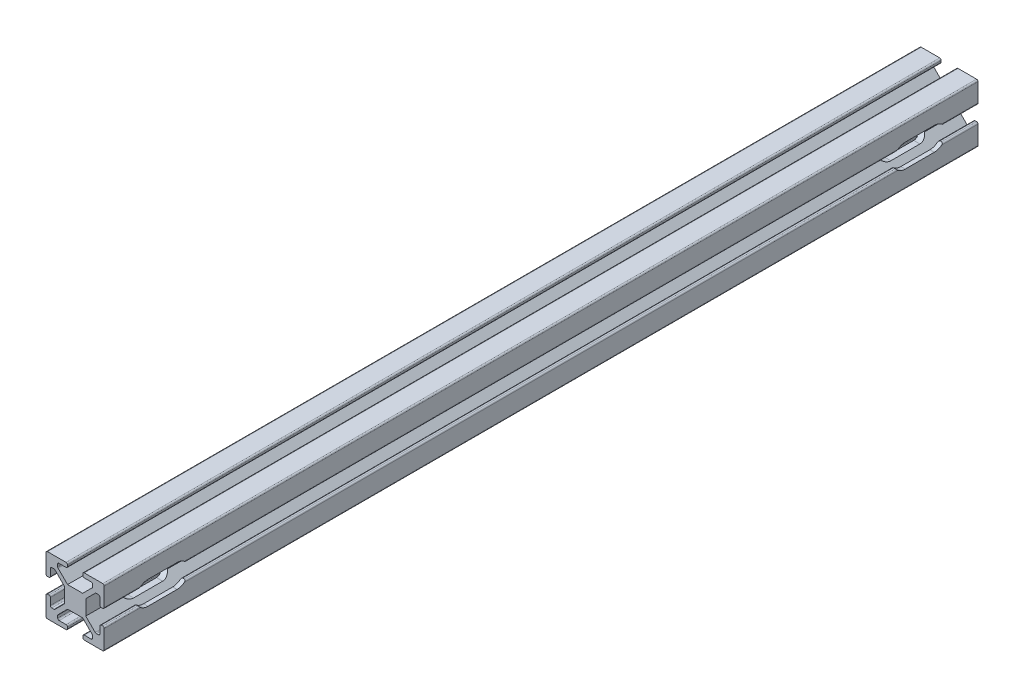
from build123d import *

# Parameters (mm, degrees)
BOSS_EXTRUDE1_DEPTH     = 300
FILLET1_R               = 0.5
CUT_EXTRUDE1_DEPTH      = 301.333148354
CUT_EXTRUDE1_DEPTH_BACK = 301.333148354


with BuildPart() as part:
    # Sketch1 → Boss-Extrude1 (new body)
    with BuildSketch(Plane.XY):
        Polygon((-10, 2.63), (-10, 10), (-2.63, 10), (-2.63, 8.5), (-5.995, 8.5), (-5.995, 7.055660172), (-2.594339828, 3.655), (2.594339828, 3.655), (5.995, 7.055660172), (5.995, 8.5), (2.63, 8.5), (2.63, 10), (10, 10), (10, 2.63), (8.5, 2.63), (8.5, 5.995), (7.055660172, 5.995), (3.655, 2.594339828), (3.655, -2.594339828), (7.055660172, -5.995), (8.5, -5.995), (8.5, -2.63), (10, -2.63), (10, -10), (2.63, -10), (2.63, -8.5), (5.995, -8.5), (5.995, -7.055660172), (2.594339828, -3.655), (-2.594339828, -3.655), (-5.995, -7.055660172), (-5.995, -8.5), (-2.63, -8.5), (-2.63, -10), (-10, -10), (-10, -2.63), (-8.5, -2.63), (-8.5, -5.995), (-7.055660172, -5.995), (-3.655, -2.594339828), (-3.655, 2.594339828), (-7.055660172, 5.995), (-8.5, 5.995), (-8.5, 2.63), align=None)
    extrude(amount=-BOSS_EXTRUDE1_DEPTH)

    # Fillet1
    fillet1_edges = [part.edges().sort_by_distance(p)[0] for p in [
        (10, 10, -150),
        (7.055660172, 5.995, -150),
        (8.5, 2.63, -150),
        (10, 2.63, -150),
        (8.5, 5.995, -150),
        (2.63, 10, -150),
        (2.63, 8.5, -150),
        (5.995, 8.5, -150),
        (5.995, 7.055660172, -150),
        (10, -10, -150),
        (10, -2.63, -150),
        (8.5, -2.63, -150),
        (8.5, -5.995, -150),
        (7.055660172, -5.995, -150),
        (5.995, -7.055660172, -150),
        (5.995, -8.5, -150),
        (2.63, -8.5, -150),
        (2.63, -10, -150),
        (-10, -10, -150),
        (-2.63, -10, -150),
        (-2.63, -8.5, -150),
        (-5.995, -8.5, -150),
        (-5.995, -7.055660172, -150),
        (-7.055660172, -5.995, -150),
        (-8.5, -5.995, -150),
        (-10, -2.63, -150),
        (-8.5, -2.63, -150),
        (-7.055660172, 5.995, -150),
        (-10, 10, -150),
        (-10, 2.63, -150),
        (-8.5, 2.63, -150),
        (-8.5, 5.995, -150),
        (-5.995, 8.5, -150),
        (-5.995, 7.055660172, -150),
        (-2.63, 8.5, -150),
        (-2.63, 10, -150),
    ]]
    fillet(fillet1_edges, radius=FILLET1_R)

    # Sketch2 → Cut-Extrude1 (cut, two sides: drawn at the far end of the back side and taken through both)
    with BuildSketch(Plane(origin=(0, 0, 0), x_dir=(0, 0, -1), z_dir=(1, 0, 0)).offset(-CUT_EXTRUDE1_DEPTH_BACK)):
        with BuildLine():
            Line((15, 4), (25, 4))
            ThreePointArc((25, 4), (29, 0), (25, -4))
            Line((25, -4), (15, -4))
            ThreePointArc((15, -4), (11, 0), (15, 4))
        make_face()
        with BuildLine():
            Line((285, 4), (275, 4))
            ThreePointArc((275, 4), (271, 0), (275, -4))
            Line((275, -4), (285, -4))
            ThreePointArc((285, -4), (289, 0), (285, 4))
        make_face()
    extrude(amount=CUT_EXTRUDE1_DEPTH + CUT_EXTRUDE1_DEPTH_BACK, mode=Mode.SUBTRACT)


solid = part.part
